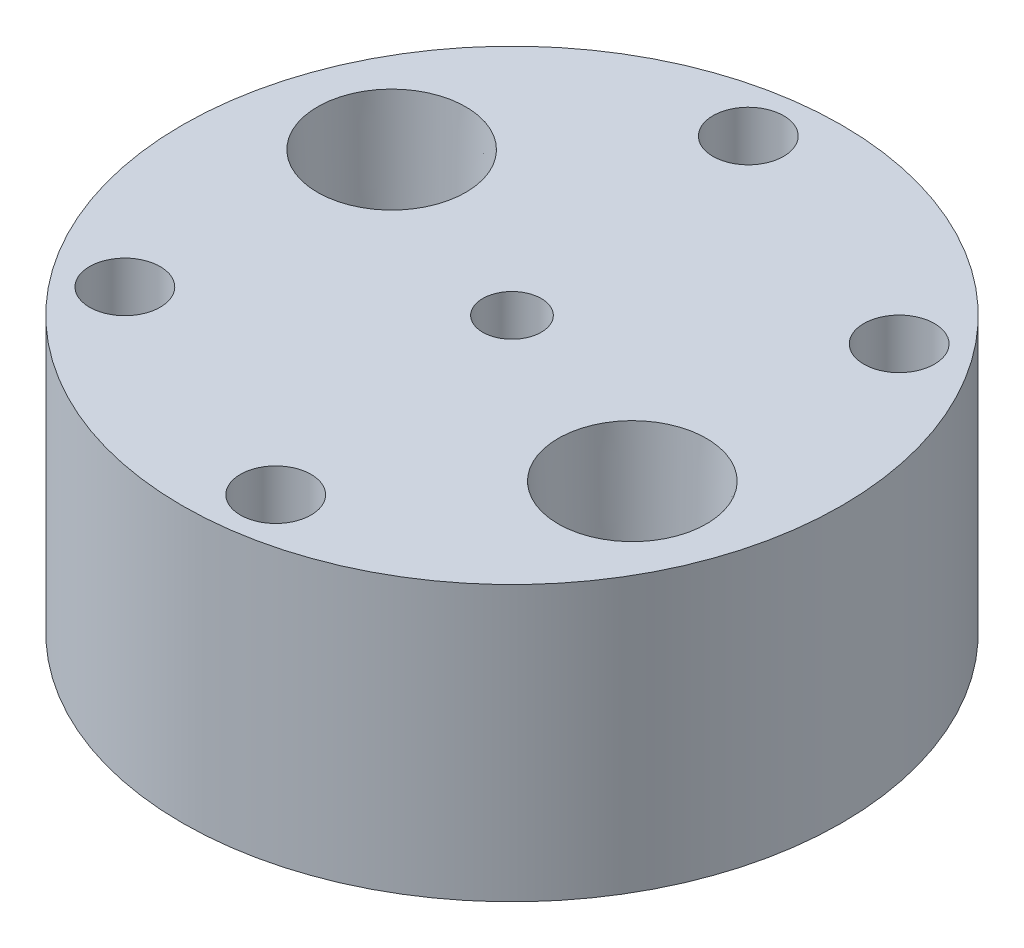
from build123d import *

# Parameters (mm, degrees)
SKETCH1_R                         = 30.48
BOSS_EXTRUDE1_DEPTH               = 25.4
F_1_4_28_TAPPED_HOLE1_D           = 5.4102
SKETCH7_R                         = 11.43
CUT_EXTRUDE2_DEPTH                = 12.7
F_1_4_CLEARANCE_HOLE1_D           = 6.5278
F_1_4_NPT_TAPPED_HOLE1_AT_2_COUNT = 2
F_1_4_NPT_TAPPED_HOLE1_AT_2_PITCH = 40.7035
CUT_EXTRUDE3_DEPTH                = 12.7
GASKET_SLOT_DEPTH                 = 1.016


with BuildPart() as part:
    # Sketch1 → Boss-Extrude1 (new body)
    with BuildSketch(Plane(origin=(0, 0, 0), x_dir=(1, 0, 0), z_dir=(0, 1, 0))):
        Circle(SKETCH1_R)
    extrude(amount=BOSS_EXTRUDE1_DEPTH)

    # 1/4-28 Tapped Hole1 (through all)
    with Locations(Plane(origin=(0, 25.4, 0), x_dir=(1, 0, 0), z_dir=(0, 1, 0))):
        with Locations((0, 0)):
            Hole(F_1_4_28_TAPPED_HOLE1_D / 2)

    # Sketch7 → Cut-Extrude2 (cut)
    with BuildSketch(Plane.XZ):
        Circle(SKETCH7_R)
    extrude(amount=-CUT_EXTRUDE2_DEPTH, mode=Mode.SUBTRACT)

    # 1/4 Clearance Hole1 (through all)
    with Locations(Plane(origin=(0, 25.4, 0), x_dir=(1, 0, 0), z_dir=(0, 1, 0))):
        with Locations((20.175514493, 15.615257641), (3.435452557, -25.280136906), (-3.435452557, 25.280136906), (-20.175514493, -15.615257641)):
            Hole(F_1_4_CLEARANCE_HOLE1_D / 2)

    # Sketch12 → 1/4 NPT Tapped Hole1 (revolve, cut)
    with BuildSketch(Plane(origin=(-18.83486521, 25.4, -7.709836613), x_dir=(0, 0, 1), z_dir=(1, 0, 0))):
        Polygon((0, 0), (0, 25.4), (5.5626, 25.4), (5.5626, 9.906), (6.557984794, 9.906), (6.8545837, 0), align=None)
    f_1_4_npt_tapped_hole1 = revolve(axis=Axis((-18.83486521, 31.75, -7.709836613), (0, -1, 0)), mode=Mode.SUBTRACT)

    # 1/4 NPT Tapped Hole1 at 2: 1/4 NPT Tapped Hole1 ×2
    with Locations(*[Vector(0.9254666163685309, 0, 0.37882917256645177) * (i * F_1_4_NPT_TAPPED_HOLE1_AT_2_PITCH) for i in range(1, F_1_4_NPT_TAPPED_HOLE1_AT_2_COUNT)]):
        add(f_1_4_npt_tapped_hole1, mode=Mode.SUBTRACT)

    # Sketch13 → Cut-Extrude3 (cut)
    with BuildSketch(Plane.XZ):
        with BuildLine():
            Line((-7.195822597, 8.880598919), (-22.336832207, -3.387945139))
            ThreePointArc((-22.336832207, -3.387945139), (-23.98286581, -9.817111768), (-18.30123054, -13.246780969))
            Line((-18.30123054, -13.246780969), (1.096509596, -11.377282923))
            ThreePointArc((1.096509596, -11.377282923), (4.330017442, -10.578083425), (7.195822597, -8.880598919))
            Line((7.195822597, -8.880598919), (22.336832207, 3.387945139))
            ThreePointArc((22.336832207, 3.387945139), (23.98286581, 9.817111768), (18.30123054, 13.246780969))
            Line((18.30123054, 13.246780969), (-1.096509596, 11.377282923))
            ThreePointArc((-1.096509596, 11.377282923), (-4.330017442, 10.578083425), (-7.195822597, 8.880598919))
        make_face()
    extrude(amount=-CUT_EXTRUDE3_DEPTH, mode=Mode.SUBTRACT)

    # Sketch16 → gasket slot (cut)
    with BuildSketch(Plane.XZ):
        with BuildLine():
            Line((18.008827981, 16.280723081), (-1.388912154, 14.411225036))
            ThreePointArc((-1.388912154, 14.411225036), (-5.48468876, 13.398905672), (-9.114708623, 11.24875863))
            Line((-9.114708623, 11.24875863), (-24.255718233, -1.019785427))
            ThreePointArc((-24.255718233, -1.019785427), (-26.803688057, -10.971783086), (-18.008827981, -16.280723081))
            Line((-18.008827981, -16.280723081), (1.388912154, -14.411225036))
            ThreePointArc((1.388912154, -14.411225036), (5.48468876, -13.398905672), (9.114708623, -11.24875863))
            Line((9.114708623, -11.24875863), (24.255718233, 1.019785427))
            ThreePointArc((24.255718233, 1.019785427), (26.803688057, 10.971783086), (18.008827981, 16.280723081))
        make_face()
        with BuildLine():
            Line((18.15502926, 14.763752025), (-1.242710875, 12.894253979))
            ThreePointArc((-1.242710875, 12.894253979), (-4.907353101, 11.988494548), (-8.15526561, 10.064678774))
            Line((-8.15526561, 10.064678774), (-23.29627522, -2.203865283))
            ThreePointArc((-23.29627522, -2.203865283), (-25.393276933, -10.394447427), (-18.15502926, -14.763752025))
            Line((-18.15502926, -14.763752025), (1.242710875, -12.894253979))
            ThreePointArc((1.242710875, -12.894253979), (4.907353101, -11.988494548), (8.15526561, -10.064678774))
            Line((8.15526561, -10.064678774), (23.29627522, 2.203865283))
            ThreePointArc((23.29627522, 2.203865283), (25.393276933, 10.394447427), (18.15502926, 14.763752025))
        make_face(mode=Mode.SUBTRACT)
    extrude(amount=-GASKET_SLOT_DEPTH, mode=Mode.SUBTRACT)


solid = part.part
